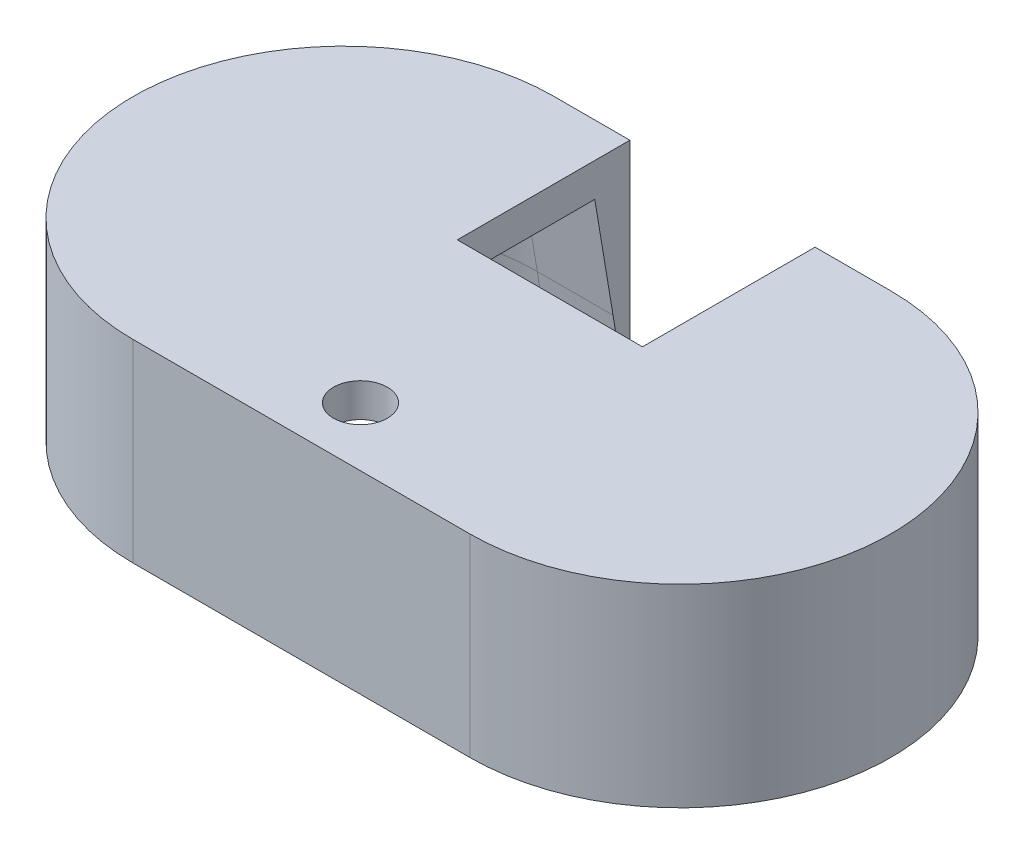
from build123d import *

# Parameters (mm, degrees)
BOSS_EXTRUDE1_DEPTH = 2
BOSS_EXTRUDE2_START = 9.5
BOSS_EXTRUDE2_DEPTH = 9.5
CHAMFER1_SIZE       = 0.5
CHAMFER1_SIZE2      = 3
CHAMFER2_SIZE       = 1.083333
CHAMFER2_SIZE_2     = 6.5
SKETCH4_W           = 11
SKETCH4_H           = 10.25
CUT_EXTRUDE1_DEPTH  = 29.191310718
SKETCH5_R           = 1.6
CUT_EXTRUDE2_DEPTH  = 29.191310718


with BuildPart() as part:
    # Sketch1 → Boss-Extrude1 (new body)
    with BuildSketch(Plane(origin=(0, 0, 0), x_dir=(1, 0, 0), z_dir=(0, 1, 0))):
        with BuildLine():
            Line((-22.5, 0), (-10, 0))
            Line((-10, 0), (0, 0))
            Line((0, 0), (0, 12.5))
            Line((0, 12.5), (-10, 12.5))
            ThreePointArc((-10, 12.5), (-18.838834765, 8.838834765), (-22.5, 0))
        make_face()
        with BuildLine():
            Line((0, 0), (-10, 0))
            Line((-10, 0), (-22.5, 0))
            ThreePointArc((-22.5, 0), (-18.838834765, -8.838834765), (-10, -12.5))
            Line((-10, -12.5), (0, -12.5))
            Line((0, -12.5), (0, 0))
        make_face()
        with BuildLine():
            Line((0, 12.5), (0, 0))
            Line((0, 0), (10, 0))
            Line((10, 0), (22.5, 0))
            ThreePointArc((22.5, 0), (18.838834765, 8.838834765), (10, 12.5))
            Line((10, 12.5), (0, 12.5))
        make_face()
        with BuildLine():
            Line((10, 0), (0, 0))
            Line((0, 0), (0, -12.5))
            Line((0, -12.5), (10, -12.5))
            ThreePointArc((10, -12.5), (18.838834765, -8.838834765), (22.5, 0))
            Line((22.5, 0), (10, 0))
        make_face()
    extrude(amount=BOSS_EXTRUDE1_DEPTH)

    # Sketch2 → Boss-Extrude2 (add)
    with BuildSketch(Plane.XZ.offset(BOSS_EXTRUDE2_START)):
        with BuildLine():
            Line((-10, -12.5), (10, -12.5))
            ThreePointArc((10, -12.5), (22.5, 0), (10, 12.5))
            Line((10, 12.5), (-10, 12.5))
            ThreePointArc((-10, 12.5), (-22.5, 0), (-10, -12.5))
        make_face()
        with BuildLine():
            Line((-10, -11.5), (10, -11.5))
            ThreePointArc((10, -11.5), (21.5, 0), (10, 11.5))
            Line((10, 11.5), (-10, 11.5))
            ThreePointArc((-10, 11.5), (-21.5, 0), (-10, -11.5))
        make_face(mode=Mode.SUBTRACT)
    extrude(amount=-BOSS_EXTRUDE2_DEPTH)

    # Chamfer1
    chamfer1_edges = [part.edges().sort_by_distance(p)[0] for p in [
        (-21.5, -9.5, 0),
        (0, -9.5, -11.5),
        (21.5, -9.5, 0),
        (0, -9.5, 11.5),
    ]]
    chamfer1_side = [part.faces().sort_by_distance(p)[0] for p in [
        (0, -9.5, -11.985218493),
    ]]
    chamfer(chamfer1_edges, length=CHAMFER1_SIZE, length2=CHAMFER1_SIZE2, reference=chamfer1_side[0])

    # Chamfer2
    # the kernel refuses this chamfer: 6.5, 1.083333 mm, written as the material it adds along each edge
    with BuildSketch(Plane(origin=(10, 0, 0), x_dir=(0, 0, -1), z_dir=(-1, 0, 0))) as chamfer2_piece_1:
        Polygon((11.5 - CHAMFER2_SIZE, 0), (11.5, CHAMFER2_SIZE_2), (11.5, 0), align=None)
    revolve(axis=Axis((10, 0, 0), (0, -1, 0)), revolution_arc=180)
    with BuildSketch(Plane(origin=(10, 0, 11.5), x_dir=(0, 0.22206230346399594, -0.9750324781156083), z_dir=(-1, 0, 0))) as chamfer2_piece_2:
        Polygon((CHAMFER2_SIZE * 0.975032478116, CHAMFER2_SIZE * 0.222062303464), (-CHAMFER2_SIZE_2 * 0.222062303464, CHAMFER2_SIZE_2 * 0.975032478116), (0, 0), align=None)
    extrude(amount=20)
    with BuildSketch(Plane(origin=(-10, 0, -11.5), x_dir=(0, -0.9999799892692318, -0.006326220127935647), z_dir=(1, 0, 0))) as chamfer2_piece_3:
        Polygon((CHAMFER2_SIZE_2 * 0.999979989269, -CHAMFER2_SIZE_2 * 0.00632622012794), (-CHAMFER2_SIZE * 0.00632622012794, -CHAMFER2_SIZE * 0.999979989269), (0, 0), align=None)
    extrude(amount=20)
    with BuildSketch(Plane(origin=(-10, 0, 0), x_dir=(0, 0, 1), z_dir=(1, 0, 0))) as chamfer2_piece_4:
        Polygon((11.5, CHAMFER2_SIZE_2), (11.5 - CHAMFER2_SIZE, 0), (11.5, 0), align=None)
    revolve(axis=Axis((-10, 0, 0), (0, -1, 0)), revolution_arc=180)

    # Sketch4 → Cut-Extrude1 (cut, through all)
    with BuildSketch(Plane(origin=(0, 2, 0), x_dir=(1, 0, 0), z_dir=(0, 1, 0))):
        with Locations((0, 7.375)):
            Rectangle(SKETCH4_W, SKETCH4_H)
    extrude(amount=-CUT_EXTRUDE1_DEPTH, mode=Mode.SUBTRACT)

    # Sketch5 → Cut-Extrude2 (cut, through all)
    with BuildSketch(Plane(origin=(0, 2, 0), x_dir=(1, 0, 0), z_dir=(0, 1, 0))):
        with Locations(Location((0, -9, 0), (0, 0, 270))):
            Circle(SKETCH5_R)
    extrude(amount=-CUT_EXTRUDE2_DEPTH, mode=Mode.SUBTRACT)


solid = part.part
